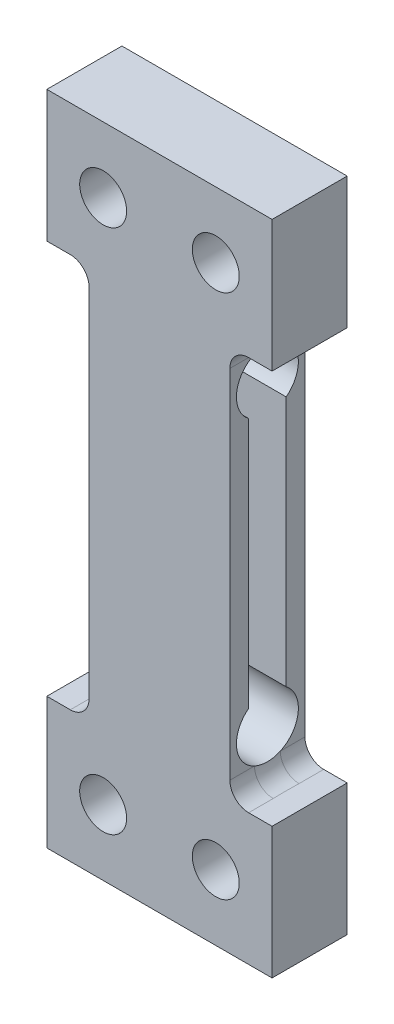
from build123d import *
from build123d.topology import SkipClean

# Parameters (mm, degrees)
SKETCH1_R                = 1.25
BOSS_EXTRUDE1_DEPTH      = 4
SKETCH2_R                = 1.65
BOSS_EXTRUDE2_DEPTH      = 3.75
SKETCH2_2_R              = 1.65
CUT_EXTRUDE1_DEPTH       = 19.338824935
MIRROR19_COPY_1_SKETCH_R = 1.25
MIRROR19_COPY_1_DEPTH    = 4
MIRROR19_COPY_2_SKETCH_R = 1.65
MIRROR19_COPY_2_DEPTH    = 3.75
MIRROR19_COPY_3_SKETCH_R = 1.65
MIRROR19_COPY_3_DEPTH    = 19.338824935
MIRROR19_COPY_4_SKETCH_R = 1.65
MIRROR19_COPY_4_DEPTH    = 3.75
MIRROR19_COPY_5_SKETCH_R = 1.65
MIRROR19_COPY_5_DEPTH    = 19.338824935
SKETCH4_W                = 2
SKETCH4_H                = 15.373217597
CUT_EXTRUDE3_DEPTH       = 21.428228019
FILLET1_R                = 1


with BuildPart() as part:
    # Sketch1 → Boss-Extrude1 (new body)
    with BuildSketch(Plane.XY):
        Polygon((0, 0), (-3.75, 0), (-3.75, -10.5), (-6, -10.5), (-6, -17.5), (0, -17.5), align=None)
        with Locations((-3, -14)):
            Circle(SKETCH1_R, mode=Mode.SUBTRACT)
    boss_extrude1 = extrude(amount=BOSS_EXTRUDE1_DEPTH)

    # Sketch2 → Boss-Extrude2 (add, through all)
    with BuildSketch(Plane.ZY.offset(3.75)):
        with Locations((2, -8)):
            Circle(SKETCH2_R)
    boss_extrude2 = extrude(amount=-BOSS_EXTRUDE2_DEPTH)

    # Sketch2<2> → Cut-Extrude1 (cut, through all)
    with BuildSketch(Plane.ZY.offset(3.75)):
        with Locations(Location((2, -8, 0), (0, 0, 270))):
            Circle(SKETCH2_2_R)
    cut_extrude1 = extrude(amount=-CUT_EXTRUDE1_DEPTH, mode=Mode.SUBTRACT)

    # Mirror6: Boss-Extrude1, Boss-Extrude2, Cut-Extrude1 across plane
    add(boss_extrude1.mirror(Plane(origin=(0, -17.5, 4), x_dir=(0, 0, 1), z_dir=(-1, 0, 0))))
    add(boss_extrude2.mirror(Plane(origin=(0, -17.5, 4), x_dir=(0, 0, 1), z_dir=(-1, 0, 0))))
    add(cut_extrude1.mirror(Plane(origin=(0, -17.5, 4), x_dir=(0, 0, 1), z_dir=(-1, 0, 0))), mode=Mode.SUBTRACT)

    # Mirror19: Boss-Extrude1 across plane
    add(boss_extrude1.mirror(Plane.ZX))

    # Mirror19 copy 1 sketch → Mirror19 copy 1 (add)
    with BuildSketch(Plane(origin=(0, 0, 0), x_dir=(-1, 0, 0), z_dir=(0, 0, 1))):
        Polygon((0, 0), (-3.75, 0), (-3.75, -10.5), (-6, -10.5), (-6, -17.5), (0, -17.5), align=None)
        with Locations((-3, -14)):
            Circle(MIRROR19_COPY_1_SKETCH_R, mode=Mode.SUBTRACT)
    extrude(amount=MIRROR19_COPY_1_DEPTH)

    # Mirror19 copy 2 sketch → Mirror19 copy 2 (add, through all)
    with BuildSketch(Plane(origin=(3.75, 0, 0), x_dir=(0, 0, 1), z_dir=(1, 0, 0))):
        with Locations((2, -8)):
            Circle(MIRROR19_COPY_2_SKETCH_R)
    extrude(amount=-MIRROR19_COPY_2_DEPTH)

    # Mirror19 copy 3 sketch → Mirror19 copy 3 (cut, through all)
    with BuildSketch(Plane(origin=(3.75, 0, 0), x_dir=(0, 0, 1), z_dir=(1, 0, 0))):
        with Locations(Location((2, -8, 0), (0, 0, 270))):
            Circle(MIRROR19_COPY_3_SKETCH_R)
    extrude(amount=-MIRROR19_COPY_3_DEPTH, mode=Mode.SUBTRACT)

    # Mirror19 copy 4 sketch → Mirror19 copy 4 (add, through all)
    with BuildSketch(Plane.ZY.offset(3.75)):
        with Locations((2, 8)):
            Circle(MIRROR19_COPY_4_SKETCH_R)
    extrude(amount=-MIRROR19_COPY_4_DEPTH)

    # Mirror19 copy 5 sketch → Mirror19 copy 5 (cut, through all)
    with BuildSketch(Plane.ZY.offset(3.75)):
        with Locations((2, 8)):
            Circle(MIRROR19_COPY_5_SKETCH_R)
    extrude(amount=-MIRROR19_COPY_5_DEPTH, mode=Mode.SUBTRACT)

    # Sketch4 → Cut-Extrude3 (cut, through all)
    with SkipClean():  # the faces are left unmerged after this step: merging them gives an invalid solid
        with BuildSketch(Plane.ZY.offset(3.75)):
            with Locations((2, -0.3266625)):
                Rectangle(SKETCH4_W, SKETCH4_H)
        extrude(amount=-CUT_EXTRUDE3_DEPTH, mode=Mode.SUBTRACT)
    add(part.part.scale(1), mode=Mode.REPLACE)  # the faces are merged on a copy

    # Fillet1
    fillet1_edges = [part.edges().sort_by_distance(p)[0] for p in [
        (-3.75, -10.5, 2),
        (3.75, -10.5, 2),
        (-3.75, 10.5, 2),
        (3.75, 10.5, 2),
    ]]
    fillet(fillet1_edges, radius=FILLET1_R)


solid = part.part
